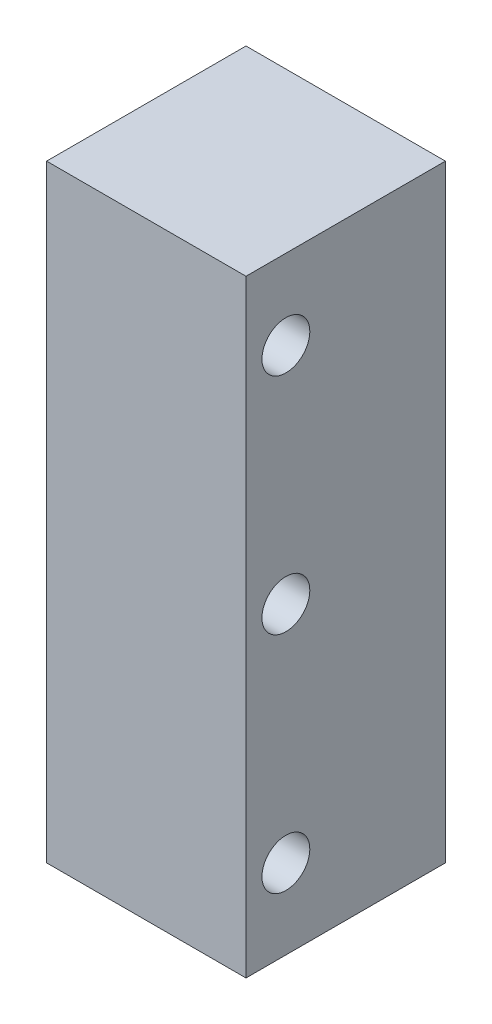
from build123d import *

# Parameters (mm, degrees)
SKETCH1_W           = 50
SKETCH1_H           = 152.4
BOSS_EXTRUDE1_DEPTH = 50
SKETCH2_R           = 6
CUT_EXTRUDE1_DEPTH  = 104.954028301


with BuildPart() as part:
    # Sketch1 → Boss-Extrude1 (new body)
    with BuildSketch(Plane.XY):
        Rectangle(SKETCH1_W, SKETCH1_H)
    extrude(amount=BOSS_EXTRUDE1_DEPTH)

    # Sketch2 → Cut-Extrude1 (cut, through all)
    with BuildSketch(Plane(origin=(25, 0, 0), x_dir=(0, 0, -1), z_dir=(1, 0, 0))):
        with Locations((-40, 56.2)):
            Circle(SKETCH2_R)
        with Locations((-40, 0)):
            Circle(SKETCH2_R)
        with Locations((-40, -56.2)):
            Circle(SKETCH2_R)
    extrude(amount=-CUT_EXTRUDE1_DEPTH, mode=Mode.SUBTRACT)


solid = part.part
